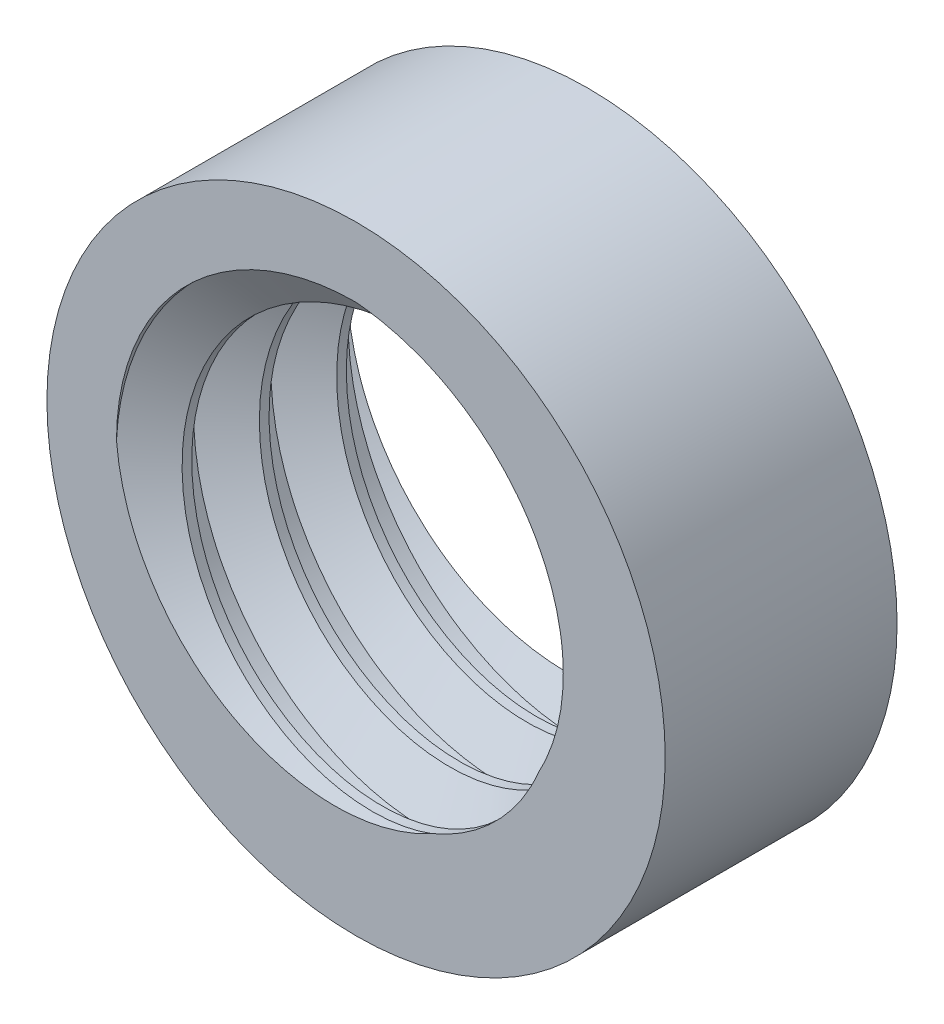
from build123d import *

# Parameters (mm, degrees)
SKETCH_1_R      = 20
SKETCH_1_R_2    = 15.5
EXTRUDE_1_DEPTH = 15
THREAD_1_PITCH  = 5
THREAD_1_FROM   = 10
THREAD_1_TO     = 25


with BuildPart() as part:
    # Sketch 1 → 보스-돌출1 (new body)
    with BuildSketch(Plane.XY):
        Circle(SKETCH_1_R)
        Circle(SKETCH_1_R_2, mode=Mode.SUBTRACT)
    extrude(amount=EXTRUDE_1_DEPTH)

    # 나사산1: arcs per turn and ends read off the stored shape
    # 나사산1: the profile of Sketch 1 2 profile screwed along a right-hand helix through 5 turns, 12 arcs to a turn; built about Z, then put on its axis
    thread_1_z = Axis((0, 0, 0), (0, 0, 1))
    thread_1_corners = [(15.5003, 0, -0.000173205), (12.793670625, 0, 1.562499993), (12.793670625, 0, 2.187499993), (15.5003, 0, 3.750173191)]
    with BuildLine(mode=Mode.PRIVATE) as thread_1_profile:
        Line(thread_1_corners[0], thread_1_corners[1])
        Line(thread_1_corners[1], thread_1_corners[2])
        Line(thread_1_corners[2], thread_1_corners[3])
        Line(thread_1_corners[3], thread_1_corners[0])
    thread_1_cap = Face(thread_1_profile.wire())
    thread_1_turn_angles = [0, 15, 30, 45, 60, 75, 90, 105, 120, 135, 150, 165, 180, 195, 210, 225, 240, 255, 270, 285, 300, 315, 330, 345, 360]
    thread_1_turn_weights = [1, 0.9659258262890683, 1, 0.9659258262890683, 1, 0.9659258262890683, 1, 0.9659258262890683, 1, 0.9659258262890683, 1, 0.9659258262890683, 1, 0.9659258262890683, 1, 0.9659258262890683, 1, 0.9659258262890683, 1, 0.9659258262890683, 1, 0.9659258262890683, 1, 0.9659258262890683, 1]
    thread_1_turn_rails = [Edge.make_bspline([Vector(p[0], p[1], 0).rotate(thread_1_z, thread_1_turn_angles[k]) / thread_1_turn_weights[k] + Vector(0, 0, p[2] + THREAD_1_PITCH * thread_1_turn_angles[k] / 360) for k in range(25)], [0, 0, 0, 1, 1, 2, 2, 3, 3, 4, 4, 5, 5, 6, 6, 7, 7, 8, 8, 9, 9, 10, 10, 11, 11, 12, 12, 12], 2, thread_1_turn_weights) for p in thread_1_corners]
    thread_1_turn_sides = [Face.make_surface_from_curves(thread_1_turn_rails[p[0]], thread_1_turn_rails[p[1]]) for p in [(0, 1), (1, 2), (2, 3), (3, 0)]]
    thread_1 = Plane(origin=(0, 0, 25), x_dir=(-1, 0, 0), z_dir=(0, 0, -1)) * split(split(Solid(Shell([*[p.moved(Location((0, 0, THREAD_1_PITCH * i))) for i in range(5) for p in thread_1_turn_sides], thread_1_cap, thread_1_cap.rotate(thread_1_z, 1800).moved(Location((0, 0, THREAD_1_PITCH * 1800 / 360)))])), bisect_by=Plane.XY.offset(THREAD_1_FROM), keep=Keep.TOP, mode=Mode.PRIVATE), bisect_by=Plane.XY.offset(THREAD_1_TO), keep=Keep.BOTTOM, mode=Mode.PRIVATE)
    add(thread_1)


solid = part.part
